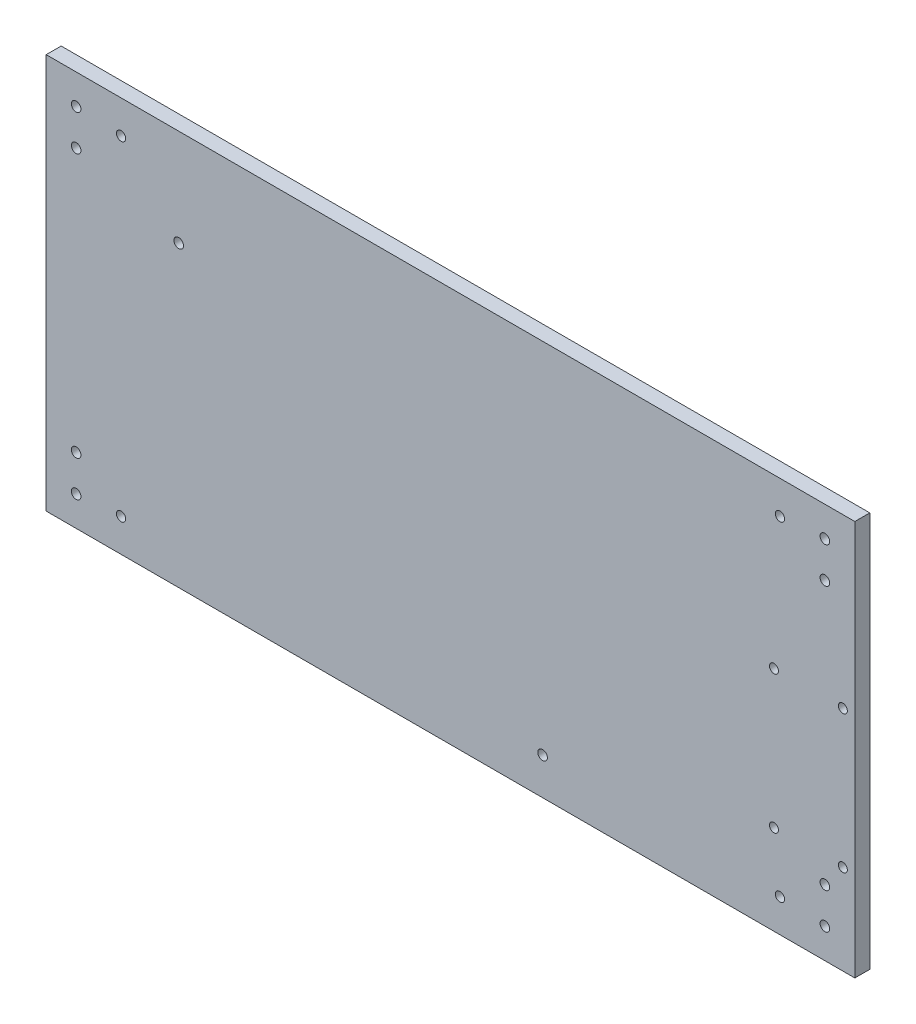
from build123d import *

# Parameters (mm, degrees)
SKETCH1_W                  = 270
SKETCH1_H                  = 132
BASE_DEPTH                 = 2.5
SKETCH3_R                  = 1.6
PSUMOUNT_DEPTH             = 151.352918163
SKETCH4_R                  = 1.5
INTERFACEHOLES_DEPTH       = 151.352918163
SKETCH5_R                  = 1.55
CUT_EXTRUDE2_DEPTH         = 151.352918163
F_3_2_3_2_WALLMOUNTHOLES_D = 3.2


with BuildPart() as part:
    # Sketch1 → Base (new, symmetric)
    with BuildSketch(Plane.XY):
        Rectangle(SKETCH1_W, SKETCH1_H)
    extrude(amount=BASE_DEPTH, both=True)

    # Sketch3 → PSUMount (cut, through all)
    with BuildSketch(Plane(origin=(0, 0, -2.5), x_dir=(-1, 0, 0), z_dir=(0, 0, -1))):
        with Locations((-30.75, -53.65)):
            Circle(SKETCH3_R)
        with Locations((90.75, 33.65)):
            Circle(SKETCH3_R)
    extrude(amount=-PSUMOUNT_DEPTH, mode=Mode.SUBTRACT)

    # Sketch4 → InterfaceHoles (cut, through all)
    with BuildSketch(Plane.XY.offset(2.5)):
        with Locations((108, 10)):
            Circle(SKETCH4_R)
        with Locations((131, 10)):
            Circle(SKETCH4_R)
        with Locations((108, -36)):
            Circle(SKETCH4_R)
        with Locations((131, -36)):
            Circle(SKETCH4_R)
    extrude(amount=-INTERFACEHOLES_DEPTH, mode=Mode.SUBTRACT)

    # Sketch5 → Cut-Extrude2 (cut, through all)
    with BuildSketch(Plane.XY.offset(2.5)):
        with Locations((-110, -55)):
            Circle(SKETCH5_R)
        with Locations((-110, 55)):
            Circle(SKETCH5_R)
        with Locations((110, 55)):
            Circle(SKETCH5_R)
        with Locations((110, -55)):
            Circle(SKETCH5_R)
    extrude(amount=-CUT_EXTRUDE2_DEPTH, mode=Mode.SUBTRACT)

    # Ø3.2 (3.2) WallMountHoles (through all)
    with Locations(Plane.XY.offset(2.5)):
        with Locations((-125, 56), (-125, 44), (-125, -44), (-125, -56), (125, -56), (125, -44), (125, 44), (125, 56)):
            Hole(F_3_2_3_2_WALLMOUNTHOLES_D / 2)


solid = part.part
